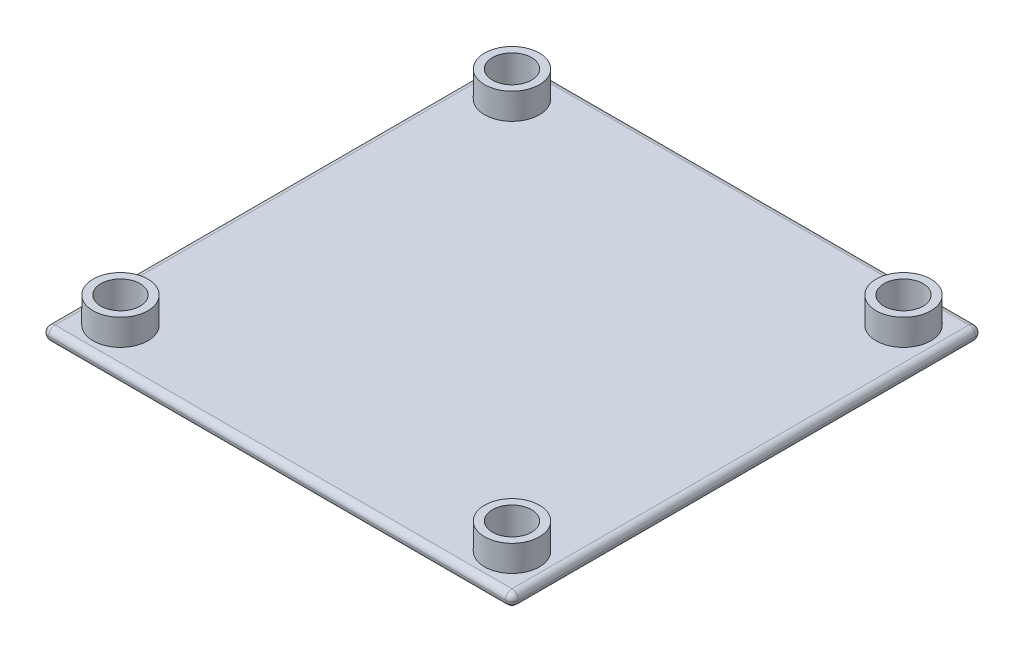
from build123d import *

# Parameters (mm, degrees)
SKETCH2_W               = 36
SKETCH2_H               = 36
SKETCH2_R               = 1.5
BOSS_EXTRUDE2_DEPTH     = 1
FILLET1_R               = 0.5
CROQUIS1_R              = 2.1
CROQUIS1_R_2            = 1.5
SALIENTE_EXTRUIR1_DEPTH = 2


with BuildPart() as part:
    # Sketch2 → Boss-Extrude2 (new body)
    with BuildSketch(Plane(origin=(0, 0, 0), x_dir=(1, 0, 0), z_dir=(0, 1, 0))):
        Rectangle(SKETCH2_W, SKETCH2_H)
        with Locations(Location((-15, 15, 0), (0, 0, 270))):
            Circle(SKETCH2_R, mode=Mode.SUBTRACT)
        with Locations(Location((-15, -15, 0), (0, 0, 270))):
            Circle(SKETCH2_R, mode=Mode.SUBTRACT)
        with Locations(Location((15, -15, 0), (0, 0, 270))):
            Circle(SKETCH2_R, mode=Mode.SUBTRACT)
        with Locations(Location((15, 15, 0), (0, 0, 270))):
            Circle(SKETCH2_R, mode=Mode.SUBTRACT)
    extrude(amount=BOSS_EXTRUDE2_DEPTH)

    # Fillet1
    fillet1_edges = [part.edges().sort_by_distance(p)[0] for p in [
        (-18, 1, 0),
        (0, 1, 18),
        (18, 1, 0),
        (0, 0, 18),
        (-18, 0, 0),
        (0, 0, -18),
        (18, 0, 0),
        (0, 1, -18),
        (18, 0.5, 18),
        (-18, 0.5, 18),
        (-18, 0.5, -18),
        (18, 0.5, -18),
    ]]
    fillet(fillet1_edges, radius=FILLET1_R - 0.0001)  # a hair under: the kernel refuses the full size

    # Croquis1 → Saliente-Extruir1 (add)
    # profile 1 of 4: a face of its own
    with BuildSketch(Plane(origin=(0, 1, 0), x_dir=(1, 0, 0), z_dir=(0, 1, 0))):
        with Locations(Location((-15, -15, 0), (0, 0, 90))):
            Circle(CROQUIS1_R)
        with Locations(Location((-15, -15, 0), (0, 0, 270))):
            Circle(CROQUIS1_R_2, mode=Mode.SUBTRACT)
    # profile 2 of 4: a face of its own
    with BuildSketch(Plane(origin=(0, 1, 0), x_dir=(1, 0, 0), z_dir=(0, 1, 0))):
        with Locations(Location((-15, 15, 0), (0, 0, 90))):
            Circle(CROQUIS1_R)
        with Locations(Location((-15, 15, 0), (0, 0, 270))):
            Circle(CROQUIS1_R_2, mode=Mode.SUBTRACT)
    # profile 3 of 4: a face of its own
    with BuildSketch(Plane(origin=(0, 1, 0), x_dir=(1, 0, 0), z_dir=(0, 1, 0))):
        with Locations(Location((15, 15, 0), (0, 0, 90))):
            Circle(CROQUIS1_R)
        with Locations(Location((15, 15, 0), (0, 0, 270))):
            Circle(CROQUIS1_R_2, mode=Mode.SUBTRACT)
    # profile 4 of 4: a face of its own
    with BuildSketch(Plane(origin=(0, 1, 0), x_dir=(1, 0, 0), z_dir=(0, 1, 0))):
        with Locations(Location((15, -15, 0), (0, 0, 90))):
            Circle(CROQUIS1_R)
        with Locations(Location((15, -15, 0), (0, 0, 270))):
            Circle(CROQUIS1_R_2, mode=Mode.SUBTRACT)
    extrude(amount=SALIENTE_EXTRUIR1_DEPTH)


solid = part.part
